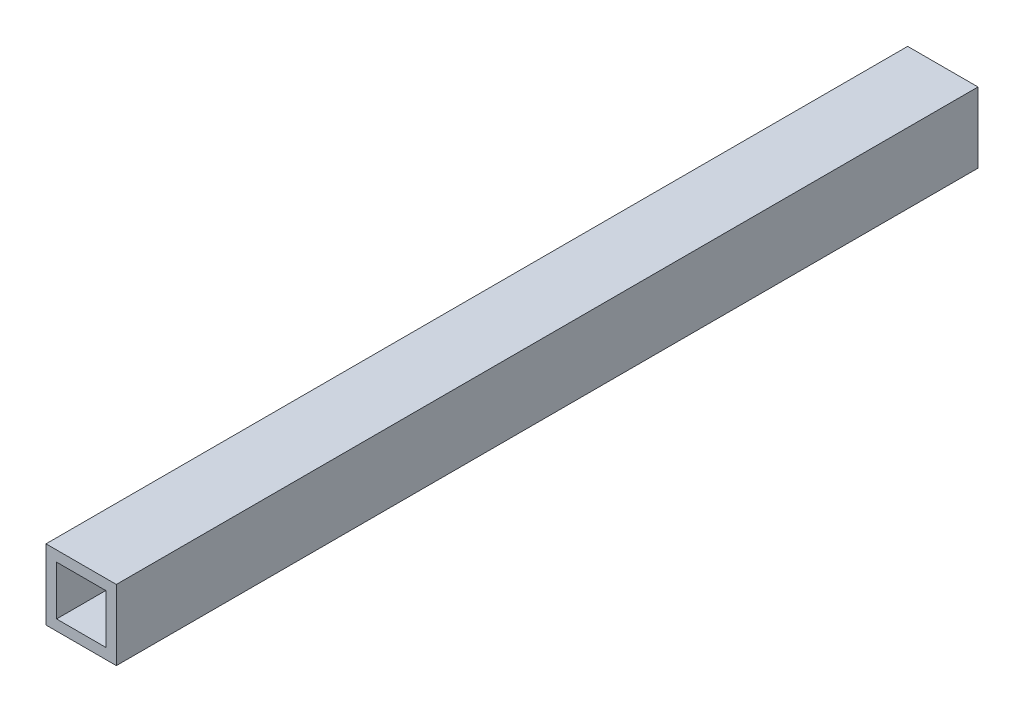
from build123d import *

# Parameters (mm, degrees)
SKETCH_1_W          = 20
SKETCH_1_H          = 20
EXTRUDE_1_DEPTH     = 245
SKETCH_2_W          = 14
SKETCH_2_H          = 14
CUT_EXTRUDE_1_DEPTH = 246.478946274


with BuildPart() as part:
    # 草图1 → 凸台-拉伸1 (new body)
    with BuildSketch(Plane.XY):
        with Locations((0.666666667, 1.006147649)):
            Rectangle(SKETCH_1_W, SKETCH_1_H)
    extrude(amount=EXTRUDE_1_DEPTH)

    # 草图2 → 切除-拉伸1 (cut, through all)
    with BuildSketch(Plane(origin=(0, 0, 0), x_dir=(-1, 0, 0), z_dir=(0, 0, -1))):
        with Locations((-0.666666667, 1.006147649)):
            Rectangle(SKETCH_2_W, SKETCH_2_H)
    extrude(amount=-CUT_EXTRUDE_1_DEPTH, mode=Mode.SUBTRACT)


solid = part.part
